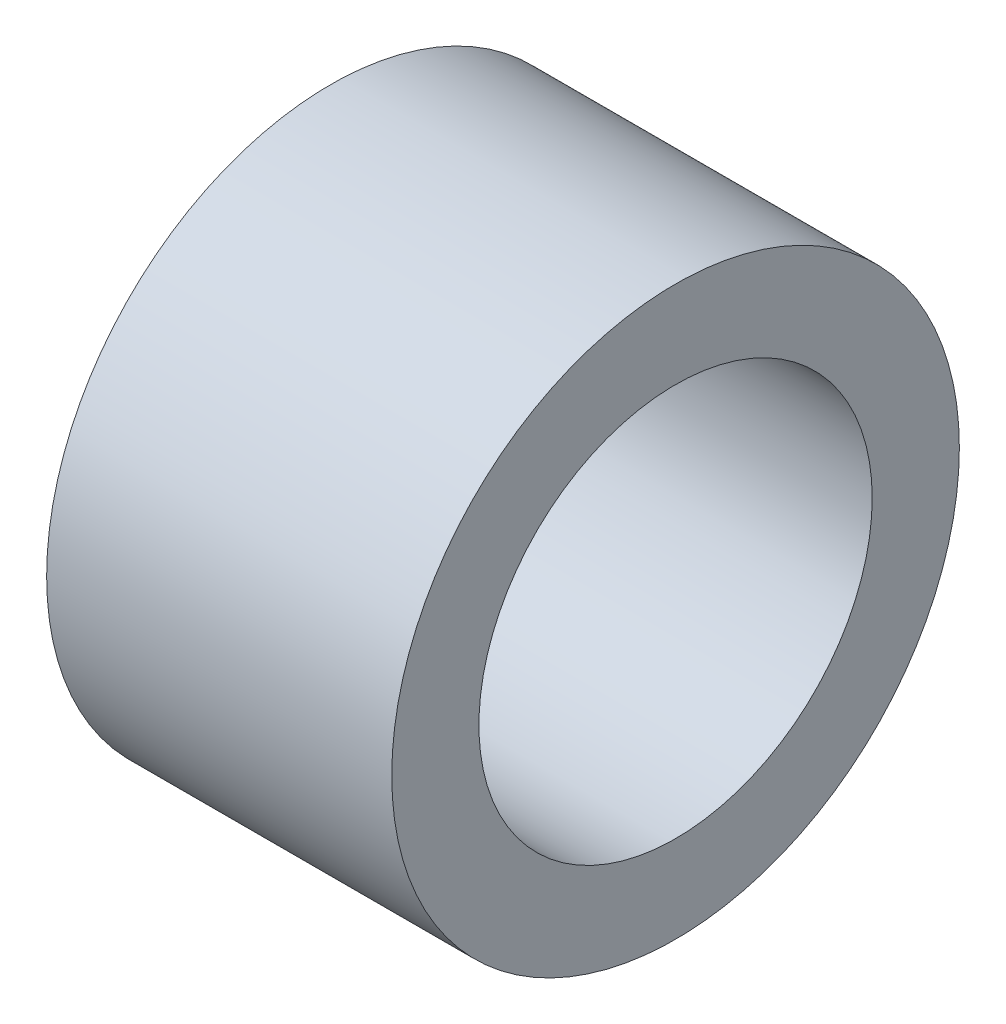
from build123d import *

# Parameters (mm, degrees)
SKETCH1_R           = 7.9375
SKETCH1_R_2         = 5.500000049
BOSS_EXTRUDE1_DEPTH = 9.652


with BuildPart() as part:
    # Sketch1 → Boss-Extrude1 (new body)
    with BuildSketch(Plane.YZ):
        Circle(SKETCH1_R)
        Circle(SKETCH1_R_2, mode=Mode.SUBTRACT)
    extrude(amount=BOSS_EXTRUDE1_DEPTH)


solid = part.part
